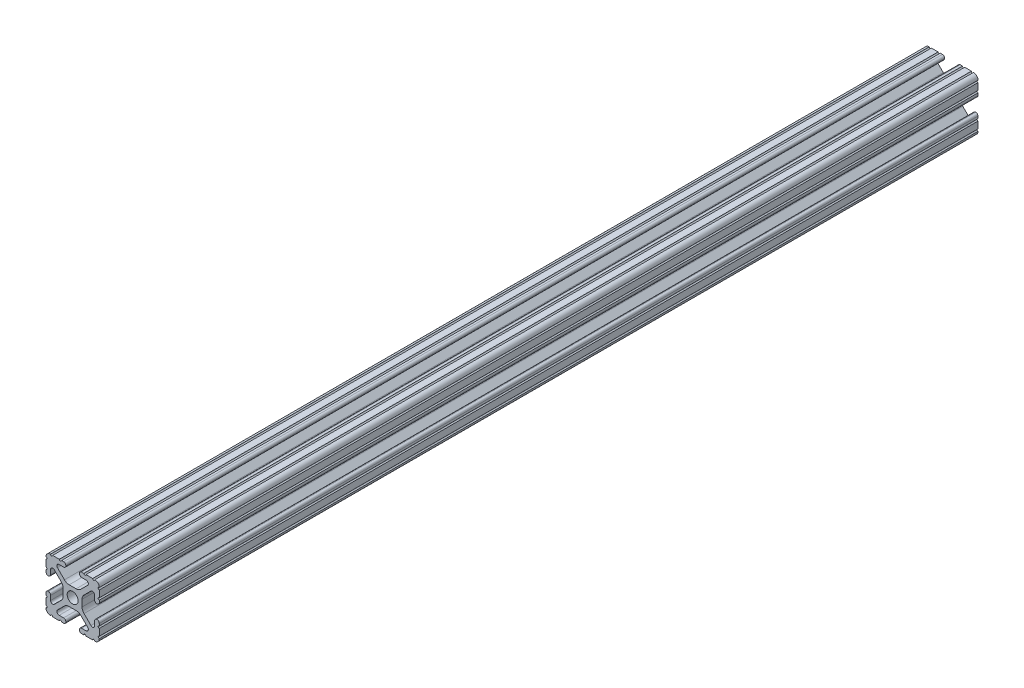
from build123d import *

# Parameters (mm, degrees)
SKETCH1_R           = 2.6035
BOSS_EXTRUDE1_DEPTH = 209.55


with BuildPart() as part:
    # Sketch1 → Boss-Extrude1 (new, symmetric)
    with BuildSketch(Plane.XY):
        with BuildLine():
            Line((-7.179650497, -8.645192506), (-3.952270251, -5.423690499))
            ThreePointArc((-3.952270251, -5.423690499), (-2.922936451, -4.736929036), (-1.709253557, -4.4958))
            Line((-1.709253557, -4.4958), (1.709253557, -4.4958))
            ThreePointArc((1.709253557, -4.4958), (2.922936451, -4.736929036), (3.952270251, -5.423690499))
            Line((3.952270251, -5.423690499), (7.179650497, -8.645192506))
            ThreePointArc((7.179650497, -8.645192506), (7.41473083, -9.822813117), (6.416408329, -10.4902))
            Line((6.416408329, -10.4902), (4.287512407, -10.4902))
            ThreePointArc((4.287512407, -10.4902), (3.54574862, -10.79744862), (3.2385, -11.539212407))
            Line((3.2385, -11.539212407), (3.2385, -11.650987593))
            ThreePointArc((3.2385, -11.650987593), (3.54574862, -12.39275138), (4.287512407, -12.7))
            Line((4.287512407, -12.7), (5.317126718, -12.7))
            ThreePointArc((5.317126718, -12.7), (5.825126718, -12.192), (6.333126718, -12.7))
            Line((6.333126718, -12.7), (9.550443118, -12.7))
            ThreePointArc((9.550443118, -12.7), (10.058366869, -12.192000006), (10.566443095, -12.699847501))
            ThreePointArc((10.566443095, -12.699847501), (12.082537762, -12.08250727), (12.699846982, -10.566399977))
            ThreePointArc((12.699846982, -10.566399977), (12.192000006, -10.058323491), (12.7, -9.5504))
            Line((12.7, -9.5504), (12.7, -6.3330836))
            ThreePointArc((12.7, -6.3330836), (12.192, -5.8250836), (12.7, -5.3170836))
            Line((12.7, -5.3170836), (12.7, -4.287469289))
            ThreePointArc((12.7, -4.287469289), (12.39275138, -3.545705502), (11.650987593, -3.238456882))
            Line((11.650987593, -3.238456882), (11.539212407, -3.238456882))
            ThreePointArc((11.539212407, -3.238456882), (10.79744862, -3.545705502), (10.4902, -4.287469289))
            Line((10.4902, -4.287469289), (10.4902, -6.402089023))
            ThreePointArc((10.4902, -6.402089023), (9.856505071, -7.351067942), (8.737131347, -7.129408934))
            Line((8.737131347, -7.129408934), (5.441005833, -3.840816462))
            ThreePointArc((5.441005833, -3.840816462), (4.750877967, -2.809883091), (4.5085, -1.593185507))
            Line((4.5085, -1.593185507), (4.5085, 1.593185507))
            ThreePointArc((4.5085, 1.593185507), (4.750877967, 2.809883091), (5.441005833, 3.840816462))
            Line((5.441005833, 3.840816462), (8.737131347, 7.129408934))
            ThreePointArc((8.737131347, 7.129408934), (9.856505071, 7.351067942), (10.4902, 6.402089023))
            Line((10.4902, 6.402089023), (10.4902, 4.287469289))
            ThreePointArc((10.4902, 4.287469289), (10.79744862, 3.545705502), (11.539212407, 3.238456882))
            Line((11.539212407, 3.238456882), (11.650987593, 3.238456882))
            ThreePointArc((11.650987593, 3.238456882), (12.39275138, 3.545705502), (12.7, 4.287469289))
            Line((12.7, 4.287469289), (12.7, 5.3170836))
            ThreePointArc((12.7, 5.3170836), (12.192, 5.8250836), (12.7, 6.3330836))
            Line((12.7, 6.3330836), (12.7, 9.5504))
            ThreePointArc((12.7, 9.5504), (12.192000006, 10.058323491), (12.699846982, 10.566399977))
            ThreePointArc((12.699846982, 10.566399977), (12.082537762, 12.08250727), (10.566443095, 12.699847501))
            ThreePointArc((10.566443095, 12.699847501), (10.058366869, 12.192000006), (9.550443118, 12.7))
            Line((9.550443118, 12.7), (6.333126718, 12.7))
            ThreePointArc((6.333126718, 12.7), (5.825126718, 12.192), (5.317126718, 12.7))
            Line((5.317126718, 12.7), (4.287512407, 12.7))
            ThreePointArc((4.287512407, 12.7), (3.54574862, 12.39275138), (3.2385, 11.650987593))
            Line((3.2385, 11.650987593), (3.2385, 11.539212407))
            ThreePointArc((3.2385, 11.539212407), (3.54574862, 10.79744862), (4.287512407, 10.4902))
            Line((4.287512407, 10.4902), (6.476788598, 10.4902))
            ThreePointArc((6.476788598, 10.4902), (7.432222385, 9.85140422), (7.207036008, 8.724370562))
            Line((7.207036008, 8.724370562), (3.898272566, 5.423169045))
            ThreePointArc((3.898272566, 5.423169045), (2.869120213, 4.736787962), (1.655778399, 4.4958))
            Line((1.655778399, 4.4958), (-1.655778399, 4.4958))
            ThreePointArc((-1.655778399, 4.4958), (-2.869120213, 4.736787962), (-3.898272566, 5.423169045))
            Line((-3.898272566, 5.423169045), (-7.207036008, 8.724370562))
            ThreePointArc((-7.207036008, 8.724370562), (-7.432222385, 9.85140422), (-6.476788598, 10.4902))
            Line((-6.476788598, 10.4902), (-4.287512407, 10.4902))
            ThreePointArc((-4.287512407, 10.4902), (-3.54574862, 10.79744862), (-3.2385, 11.539212407))
            Line((-3.2385, 11.539212407), (-3.2385, 11.650987593))
            ThreePointArc((-3.2385, 11.650987593), (-3.54574862, 12.39275138), (-4.287512407, 12.7))
            Line((-4.287512407, 12.7), (-5.317126718, 12.7))
            ThreePointArc((-5.317126718, 12.7), (-5.825126718, 12.192), (-6.333126718, 12.7))
            Line((-6.333126718, 12.7), (-9.550443118, 12.7))
            ThreePointArc((-9.550443118, 12.7), (-10.058366869, 12.192000006), (-10.566443095, 12.699847501))
            ThreePointArc((-10.566443095, 12.699847501), (-12.082537762, 12.08250727), (-12.699846982, 10.566399977))
            ThreePointArc((-12.699846982, 10.566399977), (-12.192000006, 10.058323491), (-12.7, 9.5504))
            Line((-12.7, 9.5504), (-12.7, 6.3330836))
            ThreePointArc((-12.7, 6.3330836), (-12.192, 5.8250836), (-12.7, 5.3170836))
            Line((-12.7, 5.3170836), (-12.7, 4.287469289))
            ThreePointArc((-12.7, 4.287469289), (-12.39275138, 3.545705502), (-11.650987593, 3.238456882))
            Line((-11.650987593, 3.238456882), (-11.539212407, 3.238456882))
            ThreePointArc((-11.539212407, 3.238456882), (-10.79744862, 3.545705502), (-10.4902, 4.287469289))
            Line((-10.4902, 4.287469289), (-10.4902, 6.402089023))
            ThreePointArc((-10.4902, 6.402089023), (-9.856505071, 7.351067942), (-8.737131347, 7.129408934))
            Line((-8.737131347, 7.129408934), (-5.441005833, 3.840816462))
            ThreePointArc((-5.441005833, 3.840816462), (-4.750877967, 2.809883091), (-4.5085, 1.593185507))
            Line((-4.5085, 1.593185507), (-4.5085, -1.593185507))
            ThreePointArc((-4.5085, -1.593185507), (-4.750877967, -2.809883091), (-5.441005833, -3.840816462))
            Line((-5.441005833, -3.840816462), (-8.737131347, -7.129408934))
            ThreePointArc((-8.737131347, -7.129408934), (-9.856505071, -7.351067942), (-10.4902, -6.402089023))
            Line((-10.4902, -6.402089023), (-10.4902, -4.287469289))
            ThreePointArc((-10.4902, -4.287469289), (-10.79744862, -3.545705502), (-11.539212407, -3.238456882))
            Line((-11.539212407, -3.238456882), (-11.650987593, -3.238456882))
            ThreePointArc((-11.650987593, -3.238456882), (-12.39275138, -3.545705502), (-12.7, -4.287469289))
            Line((-12.7, -4.287469289), (-12.7, -5.3170836))
            ThreePointArc((-12.7, -5.3170836), (-12.192, -5.8250836), (-12.7, -6.3330836))
            Line((-12.7, -6.3330836), (-12.7, -9.5504))
            ThreePointArc((-12.7, -9.5504), (-12.192000006, -10.058323491), (-12.699846982, -10.566399977))
            ThreePointArc((-12.699846982, -10.566399977), (-12.082537762, -12.08250727), (-10.566443095, -12.699847501))
            ThreePointArc((-10.566443095, -12.699847501), (-10.058366869, -12.192000006), (-9.550443118, -12.7))
            Line((-9.550443118, -12.7), (-6.333126718, -12.7))
            ThreePointArc((-6.333126718, -12.7), (-5.825126718, -12.192), (-5.317126718, -12.7))
            Line((-5.317126718, -12.7), (-4.287512407, -12.7))
            ThreePointArc((-4.287512407, -12.7), (-3.54574862, -12.39275138), (-3.2385, -11.650987593))
            Line((-3.2385, -11.650987593), (-3.2385, -11.539212407))
            ThreePointArc((-3.2385, -11.539212407), (-3.54574862, -10.79744862), (-4.287512407, -10.4902))
            Line((-4.287512407, -10.4902), (-6.416408329, -10.4902))
            ThreePointArc((-6.416408329, -10.4902), (-7.41473083, -9.822813117), (-7.179650497, -8.645192506))
        make_face()
        Circle(SKETCH1_R, mode=Mode.SUBTRACT)
    extrude(amount=BOSS_EXTRUDE1_DEPTH, both=True)


solid = part.part
